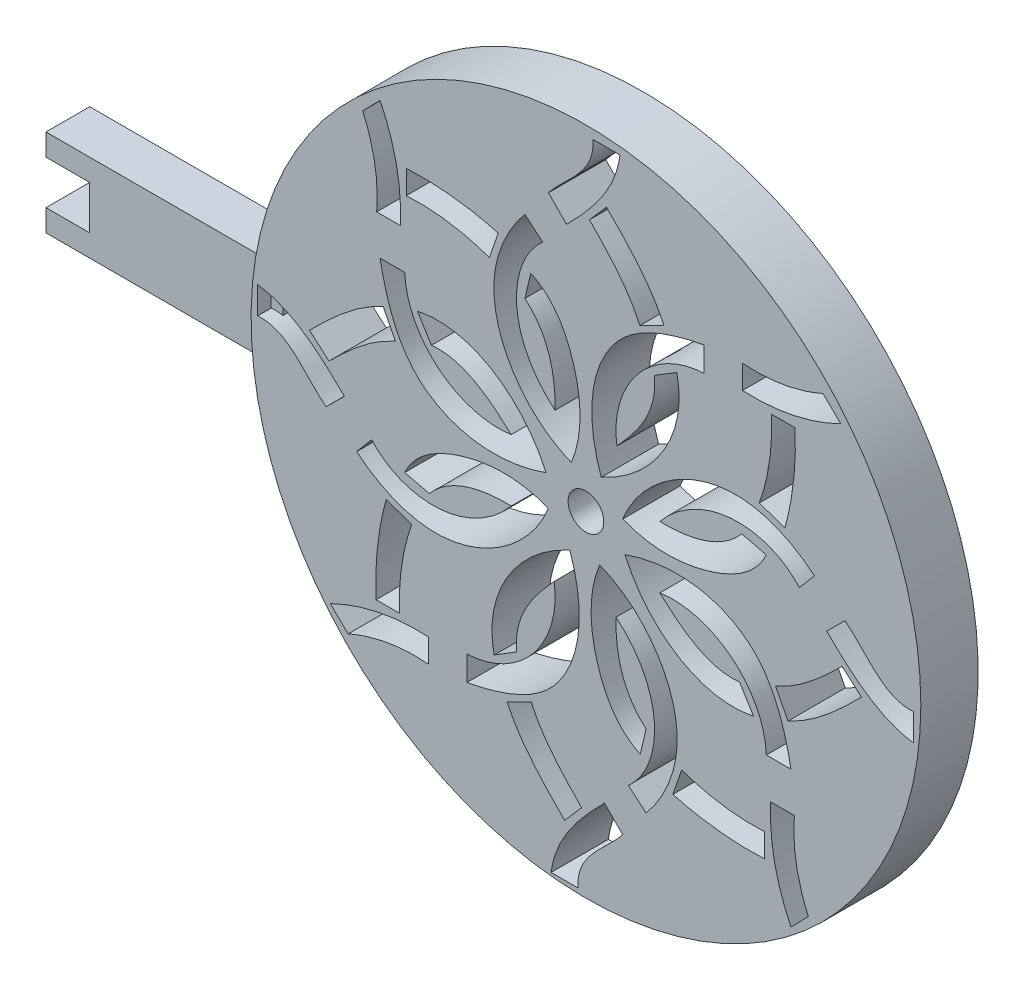
from build123d import *

# Parameters (mm, degrees)
SKETCH4_R               = 50
BOSS_EXTRUDE2_DEPTH     = 6
CUT_EXTRUDE2_DEPTH      = 71.964779997
SKETCH6_R               = 55.119060268
SKETCH6_R_2             = 46.369388515
SKETCH6_R_3             = 1.5
CUT_EXTRUDE3_DEPTH      = 71.964780146
SCALE1_SCALE            = 0.496
BOSS_EXTRUDE3_DEPTH     = 3
CUT_EXTRUDE5_DEPTH      = 46.782530459
CUT_EXTRUDE5_DEPTH_BACK = 3
SKETCH9_W               = 3
SKETCH9_H               = 3
SKETCH10_W              = 0.914456858
SKETCH10_H              = 6
BOSS_EXTRUDE4_DEPTH     = 3
SKETCH11_R              = 22.999216703
SKETCH11_R_2            = 13.977190516
CUT_EXTRUDE6_DEPTH      = 10
SCALE2_SCALE            = 1.6445
SKETCH15_R              = 44.259055913
CUT_EXTRUDE7_DEPTH      = 0.959016
BOSS_EXTRUDE5_DEPTH     = 3


with BuildPart() as part:
    # Sketch4 → Boss-Extrude2 (new body)
    with BuildSketch(Plane.XY):
        Circle(SKETCH4_R)
    extrude(amount=BOSS_EXTRUDE2_DEPTH)

    # Sketch1 → Cut-Extrude2 (cut, through all)
    with BuildSketch(Plane.XY):
        with BuildLine():
            Line((-4.513049886, 22.349308315), (-3.012603736, 21.082709366))
            add(Edge.make_bspline(
                [(-1.979829112, 9.343448951), (-3.357090824, 10.481578204), (-6.001537478, 14.307580024), (-5.105894948, 19.223939446), (-3.012603736, 21.082709366)],
                knots=[0, 0, 0, 0, 0.40658663, 1, 1, 1, 1], degree=3))
            add(Edge.make_bspline(
                [(-4.513049886, 16.22830604), (-2.515743941, 14.566039087), (-1.887211464, 11.821593781), (-1.979829112, 9.343448951)],
                knots=[0, 0, 0, 0, 1, 1, 1, 1], degree=3))
            Line((-4.513049886, 16.22830604), (-4.015942313, 18.304069107))
            add(Edge.make_bspline(
                [(-0.601470308, 6.231827141), (0.377375518, 8.591400444), (0.236846908, 13.23385399), (-2.095085284, 17.429481043), (-4.015942313, 18.304069107)],
                knots=[0, 0, 0, 0, 0.551732481, 1, 1, 1, 1], degree=3))
            add(Edge.make_bspline(
                [(-4.513049886, 22.349308315), (-5.981792021, 20.62384256), (-8.877799151, 14.307241287), (-4.460706566, 7.751250263), (-0.601470308, 6.231827141)],
                knots=[0, 0, 0, 0, 0.358841864, 1, 1, 1, 1], degree=3))
        make_face()
        with BuildLine():
            add(Edge.make_bspline(
                [(3.22740698, 9.343448951), (4.909043207, 11.157280101), (6.688633901, 13.368840393), (6.374690224, 16.05969499)],
                knots=[0, 0, 0, 0, 1, 1, 1, 1], degree=3))
            Line((6.374690224, 16.05969499), (8.272657256, 17.225361855))
            add(Edge.make_bspline(
                [(1.912768913, 6.408115869), (5.956515522, 8.194917363), (9.292374166, 12.495654324), (8.272657256, 17.225361855)],
                knots=[0, 0, 0, 0, 1, 1, 1, 1], degree=3))
            add(Edge.make_bspline(
                [(1.912768913, 6.408115869), (1.054920061, 8.783803877), (0.674685023, 12.849922496), (3.943528226, 18.699240353), (8.105775718, 19.913502428), (10.565554688, 20.378127017)],
                knots=[0, 0, 0, 0, 0.397628175, 0.593751394, 1, 1, 1, 1], degree=3))
            Line((10.565554688, 20.378127017), (10.565554688, 18.304069107))
            add(Edge.make_bspline(
                [(10.565554688, 18.304069107), (8.502124208, 18.228930014), (4.346242125, 16.097361339), (2.887005131, 11.61269277), (3.22740698, 9.343448951)],
                knots=[0, 0, 0, 0, 0.475044266, 1, 1, 1, 1], degree=3))
        make_face()
        with BuildLine():
            add(Edge.make_bspline(
                [(3.90639092, 1.765809443), (6.282078927, 2.623658295), (10.348197546, 3.003893332), (16.197515404, -0.264949871), (17.411777479, -4.427197362), (17.876402067, -6.886976332)],
                knots=[0, 0, 0, 0, 0.397628175, 0.593751394, 1, 1, 1, 1], degree=3))
            Line((17.876402067, -6.886976332), (15.802344157, -6.886976332))
            add(Edge.make_bspline(
                [(15.802344157, -6.886976332), (15.727205064, -4.823545853), (13.59563639, -0.667663769), (9.11096782, 0.791573224), (6.841724001, 0.451171375)],
                knots=[0, 0, 0, 0, 0.475044266, 1, 1, 1, 1], degree=3))
            add(Edge.make_bspline(
                [(6.841724001, 0.451171375), (8.655555152, -1.230464851), (10.867115443, -3.010055546), (13.557970041, -2.696111868)],
                knots=[0, 0, 0, 0, 1, 1, 1, 1], degree=3))
            Line((13.557970041, -2.696111868), (14.723636905, -4.5940789))
            add(Edge.make_bspline(
                [(3.90639092, 1.765809443), (5.693192413, -2.277937167), (9.993929374, -5.61379581), (14.723636905, -4.5940789)],
                knots=[0, 0, 0, 0, 1, 1, 1, 1], degree=3))
        make_face()
        with BuildLine():
            Line((5.689903292, -16.169005009), (4.189457142, -14.902406061))
            add(Edge.make_bspline(
                [(3.156682519, -3.163145646), (4.53394423, -4.301274899), (7.178390885, -8.127276719), (6.282748354, -13.043636141), (4.189457142, -14.902406061)],
                knots=[0, 0, 0, 0, 0.40658663, 1, 1, 1, 1], degree=3))
            add(Edge.make_bspline(
                [(5.689903292, -10.048002735), (3.692597347, -8.385735781), (3.06406487, -5.641290476), (3.156682519, -3.163145646)],
                knots=[0, 0, 0, 0, 1, 1, 1, 1], degree=3))
            Line((5.689903292, -10.048002735), (5.192795719, -12.123765801))
            add(Edge.make_bspline(
                [(1.778323714, -0.051523836), (0.799477888, -2.411097139), (0.940006498, -7.053550685), (3.27193869, -11.249177738), (5.192795719, -12.123765801)],
                knots=[0, 0, 0, 0, 0.551732481, 1, 1, 1, 1], degree=3))
            add(Edge.make_bspline(
                [(5.689903292, -16.169005009), (7.158645427, -14.443539255), (10.054652557, -8.126937982), (5.637559972, -1.570946958), (1.778323714, -0.051523836)],
                knots=[0, 0, 0, 0, 0.358841864, 1, 1, 1, 1], degree=3))
        make_face()
        with BuildLine():
            add(Edge.make_bspline(
                [(-0.735915506, -0.227812564), (0.121933345, -2.603500571), (0.502168383, -6.66961919), (-2.76667482, -12.518937048), (-6.928922312, -13.733199123), (-9.388701282, -14.197823711)],
                knots=[0, 0, 0, 0, 0.397628175, 0.593751394, 1, 1, 1, 1], degree=3))
            Line((-9.388701282, -14.197823711), (-9.388701282, -12.123765801))
            add(Edge.make_bspline(
                [(-9.388701282, -12.123765801), (-7.325270802, -12.048626708), (-3.169388719, -9.917058034), (-1.710151725, -5.432389465), (-2.050553574, -3.163145646)],
                knots=[0, 0, 0, 0, 0.475044266, 1, 1, 1, 1], degree=3))
            add(Edge.make_bspline(
                [(-2.050553574, -3.163145646), (-3.732189801, -4.976976796), (-5.511780495, -7.188537088), (-5.197836818, -9.879391685)],
                knots=[0, 0, 0, 0, 1, 1, 1, 1], degree=3))
            Line((-5.197836818, -9.879391685), (-7.09580385, -11.04505855))
            add(Edge.make_bspline(
                [(-0.735915506, -0.227812564), (-4.779662116, -2.014614057), (-8.11552076, -6.315351019), (-7.09580385, -11.04505855)],
                knots=[0, 0, 0, 0, 1, 1, 1, 1], degree=3))
        make_face()
        with BuildLine():
            add(Edge.make_bspline(
                [(-2.729537514, 4.414493862), (-5.105225521, 3.55664501), (-9.17134414, 3.176409973), (-15.020661998, 6.445253176), (-16.234924072, 10.607500668), (-16.699548661, 13.067279638)],
                knots=[0, 0, 0, 0, 0.397628175, 0.593751394, 1, 1, 1, 1], degree=3))
            Line((-16.699548661, 13.067279638), (-14.625490751, 13.067279638))
            add(Edge.make_bspline(
                [(-14.625490751, 13.067279638), (-14.550351658, 11.003849158), (-12.418782984, 6.847967074), (-7.934114414, 5.388730081), (-5.664870595, 5.72913193)],
                knots=[0, 0, 0, 0, 0.475044266, 1, 1, 1, 1], degree=3))
            add(Edge.make_bspline(
                [(-5.664870595, 5.72913193), (-7.478701745, 7.410768157), (-9.690262037, 9.190358851), (-12.381116635, 8.876415173)],
                knots=[0, 0, 0, 0, 1, 1, 1, 1], degree=3))
            Line((-12.381116635, 8.876415173), (-13.546783499, 10.774382205))
            add(Edge.make_bspline(
                [(-2.729537514, 4.414493862), (-4.516339007, 8.458240472), (-8.817075968, 11.794099116), (-13.546783499, 10.774382205)],
                knots=[0, 0, 0, 0, 1, 1, 1, 1], degree=3))
        make_face()
        with BuildLine():
            Line((-14.489324815, 20.715852643), (-14.489324815, 18.729529953))
            add(Edge.make_bspline(
                [(-14.489324815, 18.729529953), (-10.91120178, 18.918483112), (-7.501080441, 17.710728823)],
                knots=[0, 0, 0, 1, 1, 1], degree=2))
            Line((-7.501080441, 17.710728823), (-6.760723802, 19.86715113))
            add(Edge.make_bspline(
                [(-14.489324815, 20.715852643), (-10.565120969, 20.910780908), (-6.760723802, 19.86715113)],
                knots=[0, 0, 0, 1, 1, 1], degree=2))
        make_face()
        with BuildLine():
            add(Edge.make_bspline(
                [(-15.409167558, 7.663937203), (-17.582497361, 6.705772674), (-19.329720072, 5.062824861), (-20.9977246, 3.422184894)],
                knots=[0, 0, 0, 0, 1, 1, 1, 1], degree=3))
            Line((-20.9977246, 3.422184894), (-22.634834001, 4.844914048))
            add(Edge.make_bspline(
                [(-16.444991309, 9.687664914), (-18.855877561, 8.563228548), (-20.786213948, 6.703423132), (-22.634834001, 4.844914048)],
                knots=[0, 0, 0, 0, 1, 1, 1, 1], degree=3))
            Line((-16.444991309, 9.687664914), (-15.409167558, 7.663937203))
        make_face()
        with BuildLine():
            add(Edge.make_bspline(
                [(-17.037274287, -11.987599866), (-17.232202552, -8.063396019), (-16.188572774, -4.258998853)],
                knots=[0, 0, 0, 1, 1, 1], degree=2))
            Line((-16.188572774, -4.258998853), (-14.032150467, -4.999355492))
            add(Edge.make_bspline(
                [(-15.050951597, -11.987599866), (-15.239904756, -8.409476831), (-14.032150467, -4.999355492)],
                knots=[0, 0, 0, 1, 1, 1], degree=2))
            Line((-15.050951597, -11.987599866), (-17.037274287, -11.987599866))
        make_face()
        with BuildLine():
            add(Edge.make_bspline(
                [(15.666178221, -14.535549338), (11.741974375, -14.730477602), (7.937577208, -13.686847824)],
                knots=[0, 0, 0, 1, 1, 1], degree=2))
            Line((7.937577208, -13.686847824), (8.677933847, -11.530425518))
            add(Edge.make_bspline(
                [(15.666178221, -12.549226647), (12.088055186, -12.738179807), (8.677933847, -11.530425518)],
                knots=[0, 0, 0, 1, 1, 1], degree=2))
            Line((15.666178221, -12.549226647), (15.666178221, -14.535549338))
        make_face()
        with BuildLine():
            add(Edge.make_bspline(
                [(16.586020964, -1.483633897), (18.759350767, -0.525469368), (20.506573478, 1.117478444), (22.174578006, 2.758118411)],
                knots=[0, 0, 0, 0, 1, 1, 1, 1], degree=3))
            Line((22.174578006, 2.758118411), (23.811687407, 1.335389257))
            add(Edge.make_bspline(
                [(17.621844715, -3.507361609), (20.032730968, -2.382925243), (21.963067354, -0.523119827), (23.811687407, 1.335389257)],
                knots=[0, 0, 0, 0, 1, 1, 1, 1], degree=3))
            Line((17.621844715, -3.507361609), (16.586020964, -1.483633897))
        make_face()
        with BuildLine():
            add(Edge.make_bspline(
                [(18.214127693, 18.167903171), (18.409055958, 14.243699324), (17.36542618, 10.439302158)],
                knots=[0, 0, 0, 1, 1, 1], degree=2))
            Line((17.36542618, 10.439302158), (15.209003873, 11.179658797))
            add(Edge.make_bspline(
                [(16.227805003, 18.167903171), (16.416758162, 14.589780136), (15.209003873, 11.179658797)],
                knots=[0, 0, 0, 1, 1, 1], degree=2))
            Line((16.227805003, 18.167903171), (18.214127693, 18.167903171))
        make_face()
        with BuildLine():
            Line((1.206114652, 30.681749505), (3.489151493, 30.681749505))
            add(Edge.make_bspline(
                [(-1.008092042, 23.379811907), (0.9761821, 25.370824469), (3.119085905, 27.752948354), (3.489151493, 30.681749505)],
                knots=[0, 0, 0, 0, 1, 1, 1, 1], degree=3))
            Line((-1.008092042, 23.379811907), (-2.530186077, 24.91982738))
            add(Edge.make_bspline(
                [(1.206114652, 30.681749505), (1.438721727, 28.11146925), (-1.207492112, 26.668907949), (-2.530186077, 24.91982738)],
                knots=[0, 0, 0, 0, 1, 1, 1, 1], degree=3))
        make_face()
        with BuildLine():
            Line((13.79868904, 20.661680206), (13.79868904, 18.675357516))
            add(Edge.make_bspline(
                [(13.79868904, 18.675357516), (18.138052608, 18.457058911), (22.066967862, 20.378127017)],
                knots=[0, 0, 0, 1, 1, 1], degree=2))
            Line((22.066967862, 20.378127017), (20.570124283, 21.839819472))
            add(Edge.make_bspline(
                [(13.79868904, 20.661680206), (17.317696921, 20.388288078), (20.570124283, 21.839819472)],
                knots=[0, 0, 0, 1, 1, 1], degree=2))
        make_face()
        with BuildLine():
            Line((28.180024555, 2.472463703), (28.180024555, 0.189426862))
            add(Edge.make_bspline(
                [(20.878086958, 4.686670398), (22.86909952, 2.702396255), (25.251223404, 0.559492451), (28.180024555, 0.189426862)],
                knots=[0, 0, 0, 0, 1, 1, 1, 1], degree=3))
            Line((20.878086958, 4.686670398), (22.418102431, 6.208764432))
            add(Edge.make_bspline(
                [(28.180024555, 2.472463703), (25.609744301, 2.239856628), (24.167182999, 4.886070468), (22.418102431, 6.208764432)],
                knots=[0, 0, 0, 0, 1, 1, 1, 1], degree=3))
        make_face()
        with BuildLine():
            add(Edge.make_bspline(
                [(-12.621835634, -14.481376901), (-16.140843515, -14.207984773), (-19.393270877, -15.659516166)],
                knots=[0, 0, 0, 1, 1, 1], degree=2))
            Line((-19.393270877, -15.659516166), (-20.890114456, -14.197823711))
            add(Edge.make_bspline(
                [(-12.621835634, -12.49505421), (-16.961199202, -12.276755606), (-20.890114456, -14.197823711)],
                knots=[0, 0, 0, 1, 1, 1], degree=2))
            Line((-12.621835634, -12.49505421), (-12.621835634, -14.481376901))
        make_face()
        with BuildLine():
            add(Edge.make_bspline(
                [(-16.98310185, 16.30041399), (-16.709709722, 19.81942187), (-18.161241116, 23.071849232)],
                knots=[0, 0, 0, 1, 1, 1], degree=2))
            Line((-18.161241116, 23.071849232), (-16.699548661, 24.568692812))
            add(Edge.make_bspline(
                [(-14.99677916, 16.30041399), (-14.778480555, 20.639777557), (-16.699548661, 24.568692812)],
                knots=[0, 0, 0, 1, 1, 1], degree=2))
            Line((-14.99677916, 16.30041399), (-16.98310185, 16.30041399))
        make_face()
        with BuildLine():
            Line((-0.029261246, -24.5014462), (-2.312298087, -24.5014462))
            add(Edge.make_bspline(
                [(2.184945448, -17.199508602), (0.200671306, -19.190521164), (-1.942232499, -21.572645048), (-2.312298087, -24.5014462)],
                knots=[0, 0, 0, 0, 1, 1, 1, 1], degree=3))
            Line((2.184945448, -17.199508602), (3.707039483, -18.739524075))
            add(Edge.make_bspline(
                [(-0.029261246, -24.5014462), (-0.261868321, -21.931165945), (2.384345518, -20.488604643), (3.707039483, -18.739524075)],
                knots=[0, 0, 0, 0, 1, 1, 1, 1], degree=3))
        make_face()
        with BuildLine():
            add(Edge.make_bspline(
                [(19.847583365, 8.191628242), (18.12211761, 9.660370377), (11.805516337, 12.556377507), (5.249525313, 8.139284922), (3.730102192, 4.280048663)],
                knots=[0, 0, 0, 0, 0.358841864, 1, 1, 1, 1], degree=3))
            add(Edge.make_bspline(
                [(3.730102192, 4.280048663), (6.089675495, 3.301202838), (10.73212904, 3.441731447), (14.927756093, 5.77366364), (15.802344157, 7.694520668)],
                knots=[0, 0, 0, 0, 0.551732481, 1, 1, 1, 1], degree=3))
            Line((15.802344157, 7.694520668), (13.726581091, 8.191628242))
            add(Edge.make_bspline(
                [(13.726581091, 8.191628242), (12.064314137, 6.194322297), (9.319868831, 5.565789819), (6.841724001, 5.658407468)],
                knots=[0, 0, 0, 0, 1, 1, 1, 1], degree=3))
            add(Edge.make_bspline(
                [(6.841724001, 5.658407468), (7.979853255, 7.035669179), (11.805855075, 9.680115834), (16.722214497, 8.784473304), (18.580984416, 6.691182091)],
                knots=[0, 0, 0, 0, 0.40658663, 1, 1, 1, 1], degree=3))
            Line((18.580984416, 6.691182091), (19.847583365, 8.191628242))
        make_face()
        with BuildLine():
            add(Edge.make_bspline(
                [(-18.670729959, -2.011324936), (-16.945264204, -3.480067071), (-10.628662931, -6.376074201), (-4.072671907, -1.958981616), (-2.553248786, 1.900254642)],
                knots=[0, 0, 0, 0, 0.358841864, 1, 1, 1, 1], degree=3))
            add(Edge.make_bspline(
                [(-2.553248786, 1.900254642), (-4.912822089, 2.879100467), (-9.555275634, 2.738571858), (-13.750902687, 0.406639665), (-14.625490751, -1.514217363)],
                knots=[0, 0, 0, 0, 0.551732481, 1, 1, 1, 1], degree=3))
            Line((-14.625490751, -1.514217363), (-12.549727685, -2.011324936))
            add(Edge.make_bspline(
                [(-12.549727685, -2.011324936), (-10.887460731, -0.014018992), (-8.143015425, 0.614513486), (-5.664870595, 0.521895837)],
                knots=[0, 0, 0, 0, 1, 1, 1, 1], degree=3))
            add(Edge.make_bspline(
                [(-5.664870595, 0.521895837), (-6.802999849, -0.855365874), (-10.629001669, -3.499812529), (-15.545361091, -2.604169999), (-17.40413101, -0.510878786)],
                knots=[0, 0, 0, 0, 0.40658663, 1, 1, 1, 1], degree=3))
            Line((-17.40413101, -0.510878786), (-18.670729959, -2.011324936))
        make_face()
        with BuildLine():
            add(Edge.make_bspline(
                [(7.185939965, 20.123569664), (6.061503599, 22.534455917), (4.201698183, 24.464792304), (2.343189098, 26.313412357)],
                knots=[0, 0, 0, 0, 1, 1, 1, 1], degree=3))
            Line((2.343189098, 26.313412357), (0.920459945, 24.676302955))
            add(Edge.make_bspline(
                [(5.162212253, 19.087745914), (4.204047724, 21.261075717), (2.561099911, 23.008298428), (0.920459945, 24.676302955)],
                knots=[0, 0, 0, 0, 1, 1, 1, 1], degree=3))
            Line((5.162212253, 19.087745914), (7.185939965, 20.123569664))
        make_face()
        with BuildLine():
            Line((-3.985358847, -12.907442608), (-6.009086559, -13.943266359))
            add(Edge.make_bspline(
                [(-6.009086559, -13.943266359), (-4.884650192, -16.354152612), (-3.024844777, -18.284488999), (-1.166335692, -20.133109052)],
                knots=[0, 0, 0, 0, 1, 1, 1, 1], degree=3))
            Line((-1.166335692, -20.133109052), (0.256393461, -18.49599965))
            add(Edge.make_bspline(
                [(-3.985358847, -12.907442608), (-3.027194318, -15.080772412), (-1.384246505, -16.827995122), (0.256393461, -18.49599965)],
                knots=[0, 0, 0, 0, 1, 1, 1, 1], degree=3))
        make_face()
        with BuildLine():
            add(Edge.make_bspline(
                [(-19.701233552, 1.493632907), (-21.692246114, 3.47790705), (-24.074369998, 5.620810855), (-27.003171149, 5.990876443)],
                knots=[0, 0, 0, 0, 1, 1, 1, 1], degree=3))
            Line((-27.003171149, 5.990876443), (-27.003171149, 3.707839602))
            add(Edge.make_bspline(
                [(-27.003171149, 3.707839602), (-24.432890895, 3.940446677), (-22.990329593, 1.294232838), (-21.241249025, -0.028461127)],
                knots=[0, 0, 0, 0, 1, 1, 1, 1], degree=3))
            Line((-21.241249025, -0.028461127), (-19.701233552, 1.493632907))
        make_face()
        with BuildLine():
            add(Edge.make_bspline(
                [(18.159955256, -10.120110685), (17.886563128, -13.639118565), (19.338094522, -16.891545927)],
                knots=[0, 0, 0, 1, 1, 1], degree=2))
            Line((19.338094522, -16.891545927), (17.876402067, -18.388389507))
            add(Edge.make_bspline(
                [(16.173632566, -10.120110685), (15.955333962, -14.459474252), (17.876402067, -18.388389507)],
                knots=[0, 0, 0, 1, 1, 1], degree=2))
            Line((16.173632566, -10.120110685), (18.159955256, -10.120110685))
        make_face()
    extrude(amount=CUT_EXTRUDE2_DEPTH, mode=Mode.SUBTRACT)

    # Sketch6 → Cut-Extrude3 (cut, through all)
    # profile 1 of 2: a face of its own
    with BuildSketch(Plane(origin=(0, 0, 0), x_dir=(-1, 0, 0), z_dir=(0, 0, -1))):
        with Locations((-0.623936725, 3.264123098)):
            Circle(SKETCH6_R)
        with Locations((-0.623936725, 3.264123098)):
            Circle(SKETCH6_R_2, mode=Mode.SUBTRACT)
    # profile 2 of 2: a face of its own
    with BuildSketch(Plane(origin=(0, 0, 0), x_dir=(-1, 0, 0), z_dir=(0, 0, -1))):
        with Locations((-0.623936725, 3.264123098)):
            Circle(SKETCH6_R_3)
    extrude(amount=-CUT_EXTRUDE3_DEPTH, mode=Mode.SUBTRACT)


with BuildPart() as part_1:
    # Scale1: scaled about (0.628004608, 3.284053756, 3.000000119)
    add(part.part.scale(SCALE1_SCALE).moved(Location((0.316514322, 1.655163093, 1.51200006))))



with BuildPart() as body_2:
    # Sketch7 → Boss-Extrude3 (new body)
    with BuildSketch(Plane(origin=(0, 0, 1.51200004), x_dir=(-1, 0, 0), z_dir=(0, 0, -1))):
        Polygon((22.373109829, 3.351599312), (22.373109829, 6.351599312), (37.373109829, 6.351599312), (37.373109829, 0.351599312), (22.373109829, 0.351599312), align=None)
    extrude(amount=-BOSS_EXTRUDE3_DEPTH)

    # Sketch9 → Cut-Extrude5 (cut, two sides: drawn at the far end of the back side and taken through both)
    with BuildSketch(Plane(origin=(0, 0, 1.51200004), x_dir=(-1, 0, 0), z_dir=(0, 0, -1)).offset(-CUT_EXTRUDE5_DEPTH_BACK)):
        with Locations((35.873109829, 3.351599312)):
            Rectangle(SKETCH9_W, SKETCH9_H)
    extrude(amount=CUT_EXTRUDE5_DEPTH + CUT_EXTRUDE5_DEPTH_BACK, mode=Mode.SUBTRACT)


with BuildPart() as part_2:
    add(part_1.part)

    add(body_2.part)  # Boss-Extrude4 merges body 2
    # Sketch10 → Boss-Extrude4 (add)
    with BuildSketch(Plane(origin=(0, 0, 1.51200004), x_dir=(-1, 0, 0), z_dir=(0, 0, -1))):
        with Locations((21.9158814, 3.351599312)):
            Rectangle(SKETCH10_W, SKETCH10_H)
    extrude(amount=-BOSS_EXTRUDE4_DEPTH)

    # Sketch11 → Cut-Extrude6 (cut)
    with BuildSketch(Plane(origin=(0, 0, 1.51200004), x_dir=(-1, 0, 0), z_dir=(0, 0, -1))):
        with Locations((-0.625976541, 3.2741712)):
            Circle(SKETCH11_R)
        with Locations((-0.625976541, 3.2741712)):
            Circle(SKETCH11_R_2, mode=Mode.SUBTRACT)
    extrude(amount=-CUT_EXTRUDE6_DEPTH, mode=Mode.SUBTRACT)


with BuildPart() as cut_extrude6_piece_1:
    # of the separate pieces the step leaves, piece 1, a body of its own (cut_extrude6_pieces_kept)
    add(part_2.part.solids().sort_by_distance((-13.351213976, 3.2741712, 1.51200004))[0])


with BuildPart() as cut_extrude6_piece_2:
    # of the separate pieces the step leaves, piece 2, a body of its own (cut_extrude6_pieces_kept)
    add(part_2.part.solids().sort_by_distance((-37.373109829, 6.351599312, 1.51200004))[0])


with BuildPart() as cut_extrude6_piece_1_1:
    # Scale2: scaled about (0.632780949, 3.307529802, 3.000000253)
    add(cut_extrude6_piece_1.part.scale(SCALE2_SCALE).moved(Location((-0.407827322, -2.131702957, -1.933500163))))

    # Sketch15 → Cut-Extrude7 (cut)
    with BuildSketch(Plane(origin=(0, 0, 0.552984355), x_dir=(-1, 0, 0), z_dir=(0, 0, -1))):
        with Locations((-1.053978823, 3.49914034)):
            Circle(SKETCH15_R)
    extrude(amount=-CUT_EXTRUDE7_DEPTH, mode=Mode.SUBTRACT)


    add(cut_extrude6_piece_2.part)  # Boss-Extrude5 merges Cut-Extrude6 piece 2
    # Sketch16 → Boss-Extrude5 (add)
    with BuildSketch(Plane(origin=(0, 0, 1.51200004), x_dir=(-1, 0, 0), z_dir=(0, 0, -1))):
        with BuildLine():
            Line((21.110843661, 0.476357957), (21.110843661, 6.351599312))
            Line((21.110843661, 6.351599312), (22.166421428, 6.351599312))
            ThreePointArc((22.166421428, 6.351599312), (22.373107573, 3.352266543), (22.186794938, 0.351599312))
            Line((22.186794938, 0.351599312), (21.110843661, 0.476357957))
        make_face()
    extrude(amount=-BOSS_EXTRUDE5_DEPTH)


solid = cut_extrude6_piece_1_1.part
